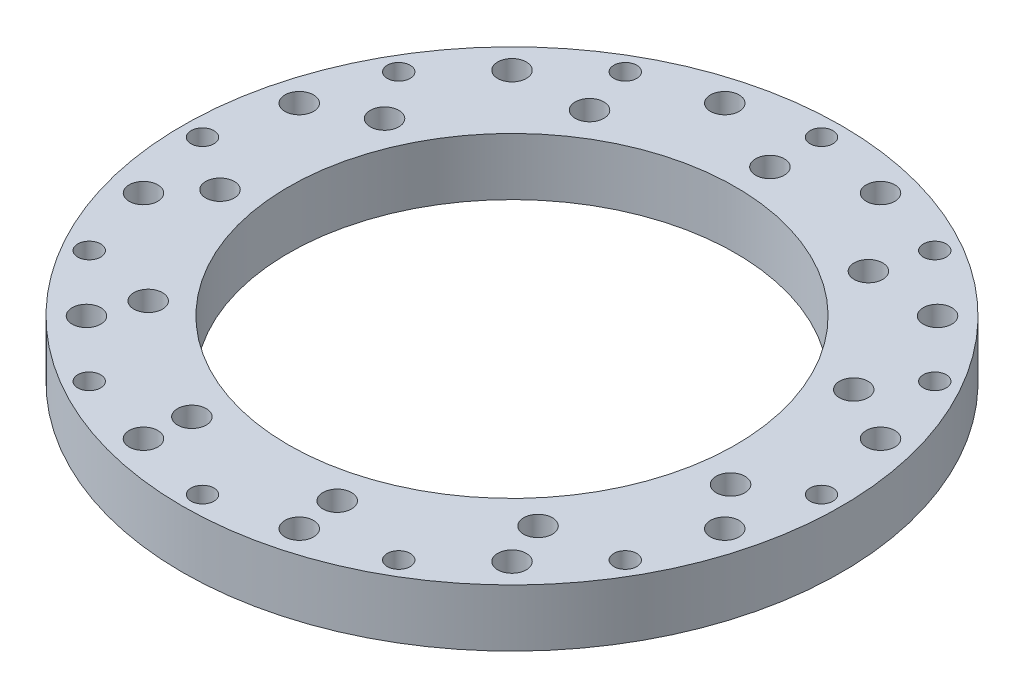
from build123d import *

# Parameters (mm, degrees)
SKETCH1_R           = 57.5
SKETCH1_R_2         = 39
SKETCH1_R_3         = 2
SKETCH1_R_4         = 2.5
BOSS_EXTRUDE1_DEPTH = 10
SKETCH2_R           = 2.5
CUT_EXTRUDE1_DEPTH  = 10


with BuildPart() as part:
    # Sketch1 → Boss-Extrude1 (new body)
    with BuildSketch(Plane(origin=(0, 0, 0), x_dir=(1, 0, 0), z_dir=(0, 1, 0))):
        Circle(SKETCH1_R)
        Circle(SKETCH1_R_2, mode=Mode.SUBTRACT)
        with Locations((0, 54)):
            Circle(SKETCH1_R_3, mode=Mode.SUBTRACT)
        with Locations((27, 46.765371804)):
            Circle(SKETCH1_R_3, mode=Mode.SUBTRACT)
        with Locations((46.765371804, 27)):
            Circle(SKETCH1_R_3, mode=Mode.SUBTRACT)
        with Locations((54, 0)):
            Circle(SKETCH1_R_3, mode=Mode.SUBTRACT)
        with Locations((46.765371804, -27)):
            Circle(SKETCH1_R_3, mode=Mode.SUBTRACT)
        with Locations((27, -46.765371804)):
            Circle(SKETCH1_R_3, mode=Mode.SUBTRACT)
        with Locations((0, -54)):
            Circle(SKETCH1_R_3, mode=Mode.SUBTRACT)
        with Locations((-27, -46.765371804)):
            Circle(SKETCH1_R_3, mode=Mode.SUBTRACT)
        with Locations((-46.765371804, -27)):
            Circle(SKETCH1_R_3, mode=Mode.SUBTRACT)
        with Locations((-54, 0)):
            Circle(SKETCH1_R_3, mode=Mode.SUBTRACT)
        with Locations((-46.765371804, 27)):
            Circle(SKETCH1_R_3, mode=Mode.SUBTRACT)
        with Locations((-27, 46.765371804)):
            Circle(SKETCH1_R_3, mode=Mode.SUBTRACT)
        with Locations((13.587999868, 50.71110588)):
            Circle(SKETCH1_R_4, mode=Mode.SUBTRACT)
        with Locations((37.123106012, 37.123106012)):
            Circle(SKETCH1_R_4, mode=Mode.SUBTRACT)
        with Locations((50.71110588, 13.587999868)):
            Circle(SKETCH1_R_4, mode=Mode.SUBTRACT)
        with Locations((50.71110588, -13.587999868)):
            Circle(SKETCH1_R_4, mode=Mode.SUBTRACT)
        with Locations((37.123106012, -37.123106012)):
            Circle(SKETCH1_R_4, mode=Mode.SUBTRACT)
        with Locations((13.587999868, -50.71110588)):
            Circle(SKETCH1_R_4, mode=Mode.SUBTRACT)
        with Locations((-13.587999868, -50.71110588)):
            Circle(SKETCH1_R_4, mode=Mode.SUBTRACT)
        with Locations((-37.123106012, -37.123106012)):
            Circle(SKETCH1_R_4, mode=Mode.SUBTRACT)
        with Locations((-50.71110588, -13.587999868)):
            Circle(SKETCH1_R_4, mode=Mode.SUBTRACT)
        with Locations((-50.71110588, 13.587999868)):
            Circle(SKETCH1_R_4, mode=Mode.SUBTRACT)
        with Locations((-37.123106012, 37.123106012)):
            Circle(SKETCH1_R_4, mode=Mode.SUBTRACT)
        with Locations((-13.587999868, 50.71110588)):
            Circle(SKETCH1_R_4, mode=Mode.SUBTRACT)
    extrude(amount=BOSS_EXTRUDE1_DEPTH)

    # Sketch2 → Cut-Extrude1 (cut)
    with BuildSketch(Plane(origin=(0, 10, 0), x_dir=(1, 0, 0), z_dir=(0, 1, 0))):
        with Locations((0, 45)):
            Circle(SKETCH2_R)
        with Locations((24.328836786, 37.856408977)):
            Circle(SKETCH2_R)
        with Locations((40.933439791, 18.693675585)):
            Circle(SKETCH2_R)
        with Locations((44.541964885, -6.404167722)):
            Circle(SKETCH2_R)
        with Locations((34.008730846, -29.468733028)):
            Circle(SKETCH2_R)
        with Locations((12.677965058, -43.177183813)):
            Circle(SKETCH2_R)
        with Locations((-12.677965058, -43.177183813)):
            Circle(SKETCH2_R)
        with Locations((-34.008730846, -29.468733028)):
            Circle(SKETCH2_R)
        with Locations((-44.541964885, -6.404167722)):
            Circle(SKETCH2_R)
        with Locations((-40.933439791, 18.693675585)):
            Circle(SKETCH2_R)
        with Locations((-24.328836786, 37.856408977)):
            Circle(SKETCH2_R)
    extrude(amount=-CUT_EXTRUDE1_DEPTH, mode=Mode.SUBTRACT)


solid = part.part
